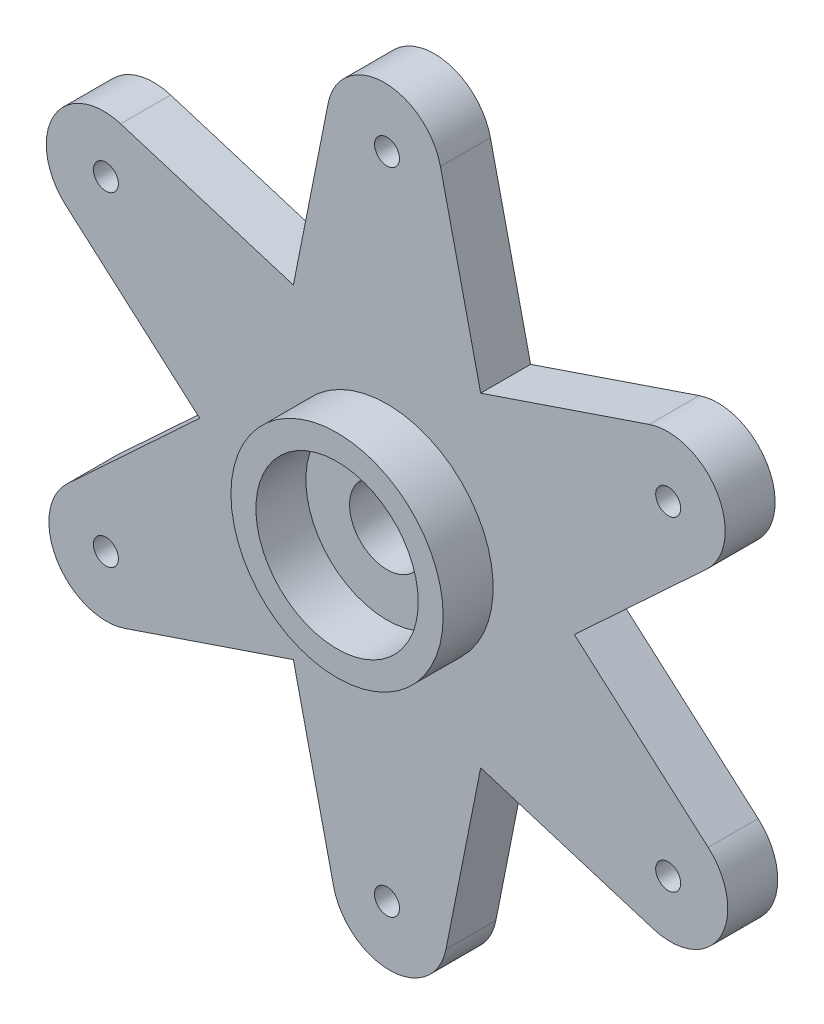
from build123d import *

# Parameters (mm, degrees)
ESBO_O1_R                = 1.5
RESSALTO_EXTRUS_O1_DEPTH = 1
ESBO_O2_R                = 4.25
ESBO_O2_R_2              = 3.25
RESSALTO_EXTRUS_O2_DEPTH = 2
ESBO_O3_R                = 0.5
CORTE_EXTRUS_O1_DEPTH    = 2


with BuildPart() as part:
    # Esboço1 → Ressalto-extrusão1 (new, symmetric)
    with BuildSketch(Plane.XY):
        with BuildLine():
            Line((3.75, 6.495190528), (2.140193877, 13.55121581))
            ThreePointArc((2.140193877, 13.55121581), (-0.135352736, 15.340099778), (-2.359806123, 13.488067011))
            Line((-2.359806123, 13.488067011), (-3.75, 6.495190528))
            Line((-3.75, 6.495190528), (-10.665600205, 8.629070172))
            ThreePointArc((-10.665600205, 8.629070172), (-13.352592472, 7.552830981), (-12.86091174, 4.700381455))
            Line((-12.86091174, 4.700381455), (-7.5, 0))
            Line((-7.5, 0), (-12.805794082, -4.922145638))
            ThreePointArc((-12.805794082, -4.922145638), (-13.217239736, -7.787268797), (-10.501105618, -8.787685556))
            Line((-10.501105618, -8.787685556), (-3.75, -6.495190528))
            Line((-3.75, -6.495190528), (-2.140193877, -13.55121581))
            ThreePointArc((-2.140193877, -13.55121581), (0.135352736, -15.340099778), (2.359806123, -13.488067011))
            Line((2.359806123, -13.488067011), (3.75, -6.495190528))
            Line((3.75, -6.495190528), (10.665600205, -8.629070172))
            ThreePointArc((10.665600205, -8.629070172), (13.352592472, -7.552830981), (12.86091174, -4.700381455))
            Line((12.86091174, -4.700381455), (7.5, 0))
            Line((7.5, 0), (12.805794082, 4.922145638))
            ThreePointArc((12.805794082, 4.922145638), (13.217239736, 7.787268797), (10.501105618, 8.787685556))
            Line((10.501105618, 8.787685556), (3.75, 6.495190528))
        make_face()
        Circle(ESBO_O1_R, mode=Mode.SUBTRACT)
    extrude(amount=RESSALTO_EXTRUS_O1_DEPTH, both=True)

    # Esboço2 → Ressalto-extrusão2 (add)
    with BuildSketch(Plane.XY.offset(1)):
        Circle(ESBO_O2_R)
        Circle(ESBO_O2_R_2, mode=Mode.SUBTRACT)
    extrude(amount=RESSALTO_EXTRUS_O2_DEPTH)

    # Esboço3 → Corte-extrusão1 (cut)
    with BuildSketch(Plane.XY.offset(1)):
        with Locations((0, 13)):
            Circle(ESBO_O3_R)
        with Locations((11.258330249, 6.5)):
            Circle(ESBO_O3_R)
        with Locations((11.258330249, -6.5)):
            Circle(ESBO_O3_R)
        with Locations((0, -13)):
            Circle(ESBO_O3_R)
        with Locations((-11.258330249, -6.5)):
            Circle(ESBO_O3_R)
        with Locations((-11.258330249, 6.5)):
            Circle(ESBO_O3_R)
    extrude(amount=-CORTE_EXTRUS_O1_DEPTH, mode=Mode.SUBTRACT)


solid = part.part
